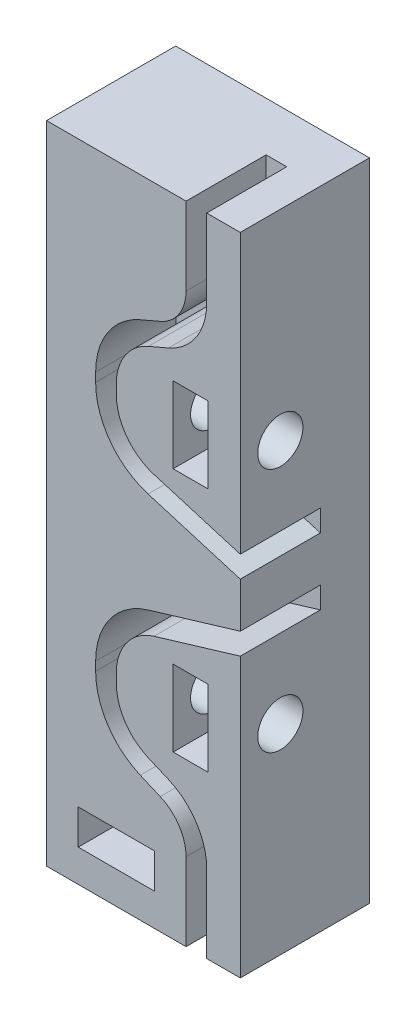
from build123d import *

# Parameters (mm, degrees)
ESQUISSE1_W                           = 15
ESQUISSE1_H                           = 10
BOSS_EXTRU_1_DEPTH                    = 25
ENL_VEMENT_START                      = -6.2
ENL_VEMENT_DE_MATI_RE_BALAYAGE1_DEPTH = 6.2
ENL_V_MAT_EXTRU_1_REACH               = 32.822
ESQUISSE4_R                           = 1.75
ENL_V_MAT_EXTRU_2_REACH               = 32.822
ESQUISSE5_W                           = 2.7
ESQUISSE5_H                           = 5.9
ENL_V_MAT_EXTRU_3_REACH               = 32.822
ESQUISSE6_W                           = 5.9
ESQUISSE6_H                           = 2.7
ESQUISSE7_R                           = 1.75
ENL_V_MAT_EXTRU_4_DEPTH               = 8.5


# Read off the part's stored shape, not the designer's step: Enlèvement de matière-Balayage1
with BuildPart() as part:
    # Esquisse1 → Boss.-Extru.1 (new body)
    with BuildSketch(Plane(origin=(0, 0, 0), x_dir=(1, 0, 0), z_dir=(0, 1, 0))):
        with Locations((7.5, 5)):
            Rectangle(ESQUISSE1_W, ESQUISSE1_H)
    extrude(amount=BOSS_EXTRU_1_DEPTH)

    # Enlèvement de matière-Balayage1 outline → Enlèvement de matière-Balayage1 (cut)
    with BuildSketch(Plane.XY.offset(ENL_VEMENT_START)):
        with BuildLine():
            Line((10.8, 25), (10.8, 18.967282711))
            ThreePointArc((10.8, 18.967282711), (10.254975604, 17.150662382), (8.799933685, 15.934104112))
            Line((8.799933685, 15.934104112), (7.254659998, 15.27184396))
            ThreePointArc((7.254659998, 15.27184396), (4.741405774, 13.170516039), (3.8, 10.032717289))
            Line((3.8, 10.032717289), (3.8, 9.348137929))
            ThreePointArc((3.8, 9.348137929), (4.926930309, 5.94563391), (7.862117052, 3.888528103))
            Line((7.862117052, 3.888528103), (15, 1.747163219))
            Line((15, 1.747163219), (15, 3.41761226))
            Line((15, 3.41761226), (8.321873669, 5.42105016))
            ThreePointArc((8.321873669, 5.42105016), (6.210598994, 6.900722757), (5.4, 9.348137929))
            Line((5.4, 9.348137929), (5.4, 10.032717289))
            ThreePointArc((5.4, 10.032717289), (6.077151522, 12.289730425), (7.884930876, 13.801211912))
            Line((7.884930876, 13.801211912), (9.430204563, 14.463472064))
            ThreePointArc((9.430204563, 14.463472064), (11.590721352, 16.269876768), (12.4, 18.967282711))
            Line((12.4, 18.967282711), (12.4, 25))
            Line((12.4, 25), (10.8, 25))
        make_face()
    extrude(amount=ENL_VEMENT_DE_MATI_RE_BALAYAGE1_DEPTH, mode=Mode.SUBTRACT)

    # Esquisse4 → Enlèv. mat.-Extru.1 (cut, up to next)
    with BuildSketch(Plane(origin=(15, 0, 0), x_dir=(0, 0, -1), z_dir=(1, 0, 0)), mode=Mode.PRIVATE) as enl_v_mat_extru_1_sk1:
        with Locations((3.1, 9.5)):
            Circle(ESQUISSE4_R)
    enl_v_mat_extru_1_tool1 = extrude(enl_v_mat_extru_1_sk1.sketch, amount=-ENL_V_MAT_EXTRU_1_REACH, mode=Mode.PRIVATE) & part.part
    add(enl_v_mat_extru_1_tool1.solids().sort_by_distance((15, 9.5, -3.1))[0], mode=Mode.SUBTRACT)

    # Esquisse5 → Enlèv. mat.-Extru.2 (cut, up to next)
    with BuildSketch(Plane.XY, mode=Mode.PRIVATE) as enl_v_mat_extru_2_sk1:
        with Locations((11.15, 9.5)):
            Rectangle(ESQUISSE5_W, ESQUISSE5_H)
    enl_v_mat_extru_2_tool1 = extrude(enl_v_mat_extru_2_sk1.sketch, amount=-ENL_V_MAT_EXTRU_2_REACH, mode=Mode.PRIVATE) & part.part
    add(enl_v_mat_extru_2_tool1.solids().sort_by_distance((11.15, 9.5, 0))[0], mode=Mode.SUBTRACT)

    # Symétrie1: part across plane


with BuildPart() as part_1:
    add(part.part)
    add(part.part.mirror(Plane(origin=(0, 0, 0), x_dir=(0, 0, 1), z_dir=(0, -1, 0))))

    # Esquisse6 → Enlèv. mat.-Extru.3 (cut, up to next)
    with BuildSketch(Plane.XY, mode=Mode.PRIVATE) as enl_v_mat_extru_3_sk1:
        with Locations((5.4, -21.15)):
            Rectangle(ESQUISSE6_W, ESQUISSE6_H)
    enl_v_mat_extru_3_tool1 = extrude(enl_v_mat_extru_3_sk1.sketch, amount=-ENL_V_MAT_EXTRU_3_REACH, mode=Mode.PRIVATE) & part_1.part
    add(enl_v_mat_extru_3_tool1.solids().sort_by_distance((5.4, -21.15, 0))[0], mode=Mode.SUBTRACT)

    # Esquisse7 → Enlèv. mat.-Extru.4 (cut)
    with BuildSketch(Plane.XZ.offset(25)):
        with Locations(Location((5.4, -5, 0), (0, 0, 270))):
            Circle(ESQUISSE7_R)
    extrude(amount=-ENL_V_MAT_EXTRU_4_DEPTH, mode=Mode.SUBTRACT)


solid = part_1.part
